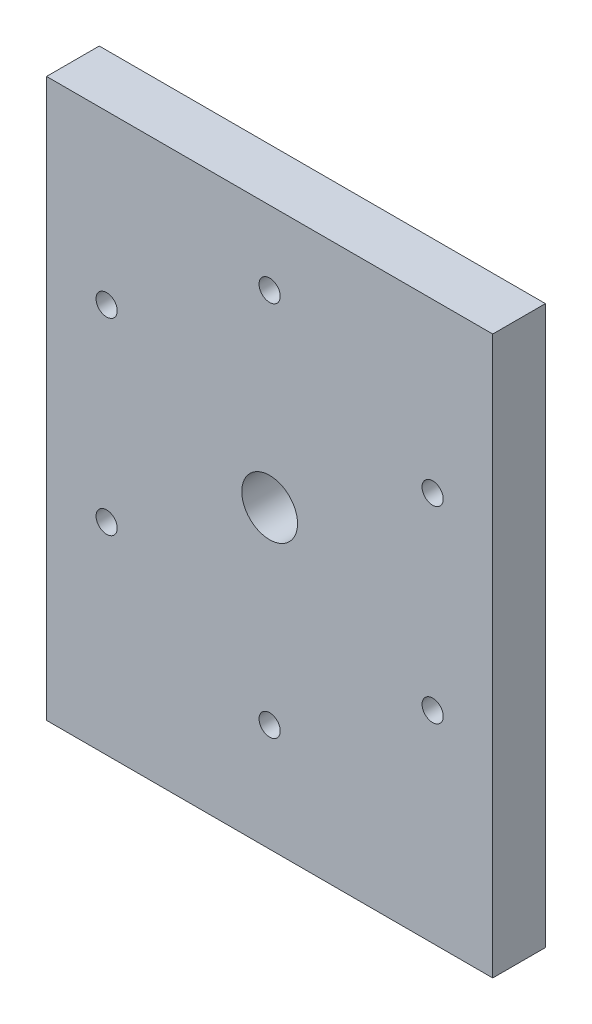
from build123d import *

# Parameters (mm, degrees)
SKETCH1_W           = 101.6
SKETCH1_H           = 127
SKETCH1_R           = 6.35
SKETCH1_R_2         = 2.413
BOSS_EXTRUDE1_DEPTH = 12.0000014


with BuildPart() as part:
    # Sketch1 → Boss-Extrude1 (new body)
    with BuildSketch(Plane.XY):
        with Locations((0, 63.5)):
            Rectangle(SKETCH1_W, SKETCH1_H)
        with Locations((0, 67.3749986)):
            Circle(SKETCH1_R, mode=Mode.SUBTRACT)
        with Locations((-37.12001387, 45.9437486)):
            Circle(SKETCH1_R_2, mode=Mode.SUBTRACT)
        with Locations((37.12001387, 45.9437486)):
            Circle(SKETCH1_R_2, mode=Mode.SUBTRACT)
        with Locations((0, 24.5124986)):
            Circle(SKETCH1_R_2, mode=Mode.SUBTRACT)
        with Locations((-37.12001387, 88.8062486)):
            Circle(SKETCH1_R_2, mode=Mode.SUBTRACT)
        with Locations((37.12001387, 88.8062486)):
            Circle(SKETCH1_R_2, mode=Mode.SUBTRACT)
        with Locations((0, 110.2374986)):
            Circle(SKETCH1_R_2, mode=Mode.SUBTRACT)
    extrude(amount=BOSS_EXTRUDE1_DEPTH)


solid = part.part
